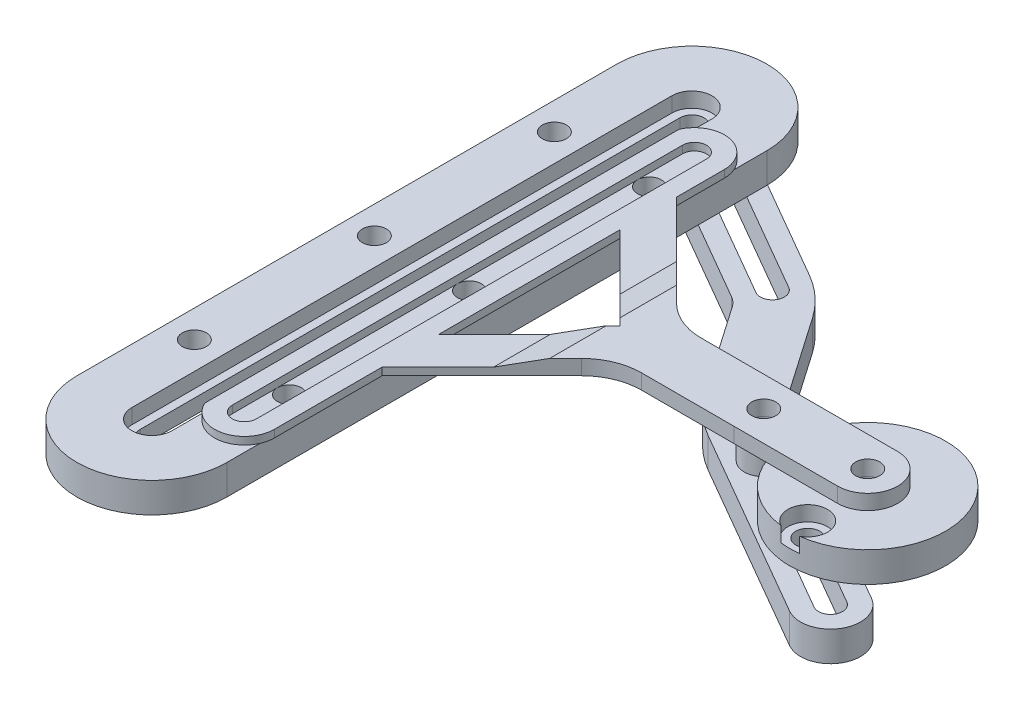
from build123d import *

# Parameters (mm, degrees)
SKETCH8_R                = 16.51
SKETCH8_R_2              = 2.54
BOSS_EXTRUDE1_DEPTH      = 6.35
SKETCH8_3_R              = 2.54
BOSS_EXTRUDE2_DEPTH      = 6.35
BOSS_EXTRUDE3_DEPTH      = 3.175
BOSS_EXTRUDE5_DEPTH      = 6.35
CUT_EXTRUDE1_DEPTH       = 289.337970876
FILLET3_R                = 5.08
FILLET4_R                = 25.4
BOSS_EXTRUDE6_DEPTH      = 3.175
BOSS_EXTRUDE6_DEPTH_BACK = 3.175
BOSS_EXTRUDE7_DEPTH      = 3.175
CUT_EXTRUDE3_DEPTH       = 3.175
SKETCH16_R               = 4.1275
SKETCH16_R_2             = 2.54
BOSS_EXTRUDE8_DEPTH      = 6.35
SKETCH17_R               = 2.54
CUT_EXTRUDE4_DEPTH       = 18.796
SKETCH18_R               = 2.54
CUT_EXTRUDE5_DEPTH       = 18.796
BOSS_EXTRUDE9_OUTLINE_R  = 2.54
BOSS_EXTRUDE9_DEPTH      = 3.175
BOSS_EXTRUDE10_DEPTH     = 1.5875
CHAMFER3_SIZE            = 17.726494926
CHAMFER3_SIZE_2          = 4.7498
SKETCH20_R               = 4.191
CUT_EXTRUDE6_DEPTH       = 3.175


# Read off the part's stored shape, not the designer's step: Boss-Extrude9
with BuildPart() as part:
    # Sketch8 → Boss-Extrude1 (new body)
    with BuildSketch(Plane(origin=(0, 0, 0), x_dir=(1, 0, 0), z_dir=(0, 1, 0))):
        with Locations(Location((201.067045256, -114.3, 0), (0, 0, 270))):
            Circle(SKETCH8_R)
        with Locations(Location((201.067045256, -127, 0), (0, 0, 270))):
            Circle(SKETCH8_R_2, mode=Mode.SUBTRACT)
    extrude(amount=BOSS_EXTRUDE1_DEPTH)

    # Sketch17 → Cut-Extrude4 (cut)
    with BuildSketch(Plane(origin=(0, 6.35, 0), x_dir=(1, 0, 0), z_dir=(0, 1, 0))):
        with Locations(Location((201.067045256, -114.3, 0), (0, 0, 270))):
            Circle(SKETCH17_R)
    extrude(amount=-CUT_EXTRUDE4_DEPTH, mode=Mode.SUBTRACT)

    # Sketch20 → Cut-Extrude6 (cut)
    with BuildSketch(Plane(origin=(0, 6.35, 0), x_dir=(1, 0, 0), z_dir=(0, 1, 0))):
        with Locations((201.067045256, -127)):
            Circle(SKETCH20_R)
    extrude(amount=-CUT_EXTRUDE6_DEPTH, mode=Mode.SUBTRACT)


with BuildPart() as body_2:
    # Sketch8<3> → Boss-Extrude2 (new body)
    with BuildSketch(Plane(origin=(0, 0, 0), x_dir=(1, 0, 0), z_dir=(0, 1, 0))):
        with BuildLine():
            ThreePointArc((209.32976593, -139.102832424), (218.004027244, -136.77857111), (215.67976593, -128.104309796))
            Line((215.67976593, -128.104309796), (110.754602918, -67.525738686))
            ThreePointArc((110.754602918, -67.525738686), (102.080341604, -69.85), (104.404602918, -78.524261314))
            Line((104.404602918, -78.524261314), (209.32976593, -139.102832424))
        make_face()
        with BuildLine():
            ThreePointArc((213.77476593, -131.403866584), (214.704470456, -134.87357111), (211.23476593, -135.803275636))
            Line((211.23476593, -135.803275636), (183.73845936, -119.928275636))
            ThreePointArc((183.73845936, -119.928275636), (182.808754834, -116.45857111), (186.27845936, -115.528866584))
            Line((186.27845936, -115.528866584), (213.77476593, -131.403866584))
        make_face(mode=Mode.SUBTRACT)
        with Locations(Location((179.07, -114.3, 0), (0, 0, 270))):
            Circle(SKETCH8_3_R, mode=Mode.SUBTRACT)
    extrude(amount=-BOSS_EXTRUDE2_DEPTH)

    # Sketch9 → Boss-Extrude5 (add)
    with BuildSketch(Plane.XZ.offset(6.35)):
        with BuildLine():
            Line((158.063383303, 82.98668464), (171.74208472, 102.736877722))
            Line((171.74208472, 102.736877722), (110.754602918, 67.525738686))
            ThreePointArc((110.754602918, 67.525738686), (105.936101981, 66.891371003), (102.080341604, 69.85))
            Line((102.080341604, 69.85), (98.350066501, 67.696324666))
            Line((98.350066501, 67.696324666), (105.335066501, 55.597949775))
            ThreePointArc((105.335066501, 55.597949775), (108.419674804, 53.231046577), (112.274475553, 53.738540724))
            Line((112.274475553, 53.738540724), (149.882418833, 75.4514969))
            ThreePointArc((149.882418833, 75.4514969), (154.390412826, 78.765797637), (158.063383303, 82.98668464))
        make_face()
        with BuildLine():
            Line((108.929327815, 62.072506563), (147.424157014, 84.297506563))
            ThreePointArc((147.424157014, 84.297506563), (150.893861539, 83.367802038), (149.964157014, 79.898097512))
            Line((149.964157014, 79.898097512), (111.469327815, 57.673097512))
            ThreePointArc((111.469327815, 57.673097512), (107.99962329, 58.602802038), (108.929327815, 62.072506563))
        make_face(mode=Mode.SUBTRACT)
    extrude(amount=-BOSS_EXTRUDE5_DEPTH)

    # Sketch10 → Cut-Extrude1 (cut, through all)
    with BuildSketch(Plane.XZ.offset(6.35)):
        with BuildLine():
            Line((163.667728403, 112.739842766), (104.404602918, 78.524261314))
            ThreePointArc((104.404602918, 78.524261314), (101.445973921, 74.668500936), (102.080341604, 69.85))
            Line((102.080341604, 69.85), (98.350066501, 67.696324666))
            Line((98.350066501, 67.696324666), (101.525066501, 62.197063352))
            Line((101.525066501, 62.197063352), (145.519157014, 87.597063352))
            ThreePointArc((145.519157014, 87.597063352), (146.557191217, 88.345236074), (147.424157014, 89.286324666))
            Line((147.424157014, 89.286324666), (163.667728403, 112.739842766))
        make_face()
    extrude(amount=-CUT_EXTRUDE1_DEPTH, mode=Mode.SUBTRACT)

    # Fillet3
    fillet3_edges = [body_2.edges().sort_by_distance(p)[0] for p in [
        (101.525066501, -3.175, 62.197063352),
    ]]
    fillet(fillet3_edges, radius=FILLET3_R)

    # Fillet4
    fillet4_edges = [body_2.edges().sort_by_distance(p)[0] for p in [
        (163.667728403, -3.175, 112.739842766),
        (171.74208472, -3.175, 102.736877722),
    ]]
    fillet(fillet4_edges, radius=FILLET4_R)

    # Sketch16 → Boss-Extrude8 (add)
    with BuildSketch(Plane(origin=(0, 0, 0), x_dir=(1, 0, 0), z_dir=(0, 1, 0))):
        with Locations(Location((179.07, -114.3, 0), (0, 0, 270))):
            Circle(SKETCH16_R)
        with Locations(Location((179.07, -114.3, 0), (0, 0, 270))):
            Circle(SKETCH16_R_2, mode=Mode.SUBTRACT)
    extrude(amount=BOSS_EXTRUDE8_DEPTH)


with BuildPart() as body_3:
    # Sketch8<4> → Boss-Extrude3 (new body)
    with BuildSketch(Plane(origin=(0, 0, 0), x_dir=(1, 0, 0), z_dir=(0, 1, 0))):
        with BuildLine():
            Line((122.555, -63.471788223), (122.555, -177.771788223))
            ThreePointArc((122.555, -177.771788223), (113.03, -187.296788223), (103.505, -177.771788223))
            Line((103.505, -177.771788223), (103.505, -63.471788223))
            ThreePointArc((103.505, -63.471788223), (113.03, -53.946788223), (122.555, -63.471788223))
        make_face()
        with BuildLine():
            Line((115.57, -63.471788223), (115.57, -177.771788223))
            ThreePointArc((115.57, -177.771788223), (113.03, -180.311788223), (110.49, -177.771788223))
            Line((110.49, -177.771788223), (110.49, -63.471788223))
            ThreePointArc((110.49, -63.471788223), (113.03, -60.931788223), (115.57, -63.471788223))
        make_face(mode=Mode.SUBTRACT)
    extrude(amount=BOSS_EXTRUDE3_DEPTH)

    # Sketch12 → Boss-Extrude6 (add, two sides: drawn at the far end of the back side and taken through both)
    with BuildSketch(Plane.XZ.offset(-BOSS_EXTRUDE6_DEPTH_BACK)):
        with BuildLine():
            Line((97.155, 63.471788223), (97.155, 177.771788223))
            ThreePointArc((97.155, 177.771788223), (113.03, 193.646788223), (128.905, 177.771788223))
            Line((128.905, 177.771788223), (128.905, 63.471788223))
            ThreePointArc((128.905, 63.471788223), (113.03, 47.596788223), (97.155, 63.471788223))
        make_face()
        with BuildLine():
            Line((122.555, 63.471788223), (122.555, 177.771788223))
            ThreePointArc((122.555, 177.771788223), (113.03, 187.296788223), (103.505, 177.771788223))
            Line((103.505, 177.771788223), (103.505, 63.471788223))
            ThreePointArc((103.505, 63.471788223), (113.03, 53.946788223), (122.555, 63.471788223))
        make_face(mode=Mode.SUBTRACT)
    extrude(amount=BOSS_EXTRUDE6_DEPTH + BOSS_EXTRUDE6_DEPTH_BACK)

    # Sketch13 → Boss-Extrude7 (add)
    with BuildSketch(Plane(origin=(0, 3.175, 0), x_dir=(1, 0, 0), z_dir=(0, 1, 0))):
        with BuildLine():
            Line((128.905, -177.771788223), (128.905, -63.471788223))
            ThreePointArc((128.905, -63.471788223), (113.03, -47.596788223), (97.155, -63.471788223))
            Line((97.155, -63.471788223), (97.155, -177.771788223))
            ThreePointArc((97.155, -177.771788223), (113.03, -193.646788223), (128.905, -177.771788223))
        make_face()
        with BuildLine():
            ThreePointArc((117.28, -63.471788223), (113.03, -59.221788223), (108.78, -63.471788223))
            Line((108.78, -63.471788223), (108.78, -177.771788223))
            ThreePointArc((108.78, -177.771788223), (113.03, -182.021788223), (117.28, -177.771788223))
            Line((117.28, -177.771788223), (117.28, -63.471788223))
        make_face(mode=Mode.SUBTRACT)
    extrude(amount=BOSS_EXTRUDE7_DEPTH)

    # Sketch15 → Cut-Extrude3 (cut)
    with BuildSketch(Plane.XZ.offset(3.175)):
        with BuildLine():
            Line((128.905, 63.471788223), (128.905, 177.771788223))
            ThreePointArc((128.905, 177.771788223), (113.03, 193.646788223), (97.155, 177.771788223))
            Line((97.155, 177.771788223), (97.155, 63.471788223))
            ThreePointArc((97.155, 63.471788223), (113.03, 47.596788223), (128.905, 63.471788223))
        make_face()
    extrude(amount=-CUT_EXTRUDE3_DEPTH, mode=Mode.SUBTRACT)

    # Sketch18 → Cut-Extrude5 (cut)
    with BuildSketch(Plane(origin=(0, 6.35, 0), x_dir=(1, 0, 0), z_dir=(0, 1, 0))):
        with Locations(Location((123.0925, -158.721788223, 0), (0, 0, 270))):
            Circle(SKETCH18_R)
        with Locations(Location((123.0925, -82.521788223, 0), (0, 0, 270))):
            Circle(SKETCH18_R)
        with Locations(Location((123.0925, -120.621788223, 0), (0, 0, 270))):
            Circle(SKETCH18_R)
        with Locations(Location((102.9675, -82.521788223, 0), (0, 0, 270))):
            Circle(SKETCH18_R)
        with Locations(Location((102.9675, -120.621788223, 0), (0, 0, 270))):
            Circle(SKETCH18_R)
        with Locations(Location((102.9675, -158.721788223, 0), (0, 0, 270))):
            Circle(SKETCH18_R)
    extrude(amount=-CUT_EXTRUDE5_DEPTH, mode=Mode.SUBTRACT)


with BuildPart() as body_4:
    # Boss-Extrude9 outline → Boss-Extrude9 (new body)
    with BuildSketch(Plane(origin=(0, 6.35, 0), x_dir=(1, 0, 0), z_dir=(0, 1, 0))):
        with BuildLine():
            Line((201.067045256, -107.95), (159.516762242, -107.95))
            ThreePointArc((159.516762242, -107.95), (154.656682651, -106.983270063), (150.536506121, -104.230256121))
            Line((150.536506121, -104.230256121), (129.4425, -83.13625))
            Line((129.4425, -83.13625), (129.4425, -95.124030717))
            Line((129.4425, -95.124030717), (148.618469283, -114.3))
            Line((148.618469283, -114.3), (129.4425, -133.475969283))
            Line((129.4425, -133.475969283), (129.4425, -145.449644111))
            Line((129.4425, -145.449644111), (150.533515322, -124.358628789))
            ThreePointArc((150.533515322, -124.358628789), (154.657027058, -121.604233915), (159.52099102, -120.638886962))
            Line((159.52099102, -120.638886962), (179.07, -120.65))
            Line((179.07, -120.65), (201.067045256, -120.65))
            ThreePointArc((201.067045256, -120.65), (207.417045256, -114.3), (201.067045256, -107.95))
        make_face()
        with Locations((179.07, -114.3)):
            Circle(BOSS_EXTRUDE9_OUTLINE_R, mode=Mode.SUBTRACT)
        with Locations((201.067045256, -114.3)):
            Circle(BOSS_EXTRUDE9_OUTLINE_R, mode=Mode.SUBTRACT)
    extrude(amount=BOSS_EXTRUDE9_DEPTH)

    # Sketch19<3> → Boss-Extrude10 (add)
    # profile 1 of 2: a face of its own
    with BuildSketch(Plane(origin=(0, 6.35, 0), x_dir=(1, 0, 0), z_dir=(0, 1, 0))):
        with BuildLine():
            Line((117.28, -70.439965243), (117.28, -170.803611203))
            ThreePointArc((117.28, -170.803611203), (123.0925, -174.596788223), (128.905, -170.803611203))
            Line((128.905, -170.803611203), (128.905, -70.439965243))
            ThreePointArc((128.905, -70.439965243), (123.0925, -66.646788223), (117.28, -70.439965243))
        make_face()
        with BuildLine():
            ThreePointArc((125.6325, -168.246788223), (123.0925, -170.786788223), (120.5525, -168.246788223))
            Line((120.5525, -168.246788223), (120.5525, -158.721788223))
            Line((120.5525, -158.721788223), (120.5525, -120.621788223))
            Line((120.5525, -120.621788223), (120.5525, -82.521788223))
            Line((120.5525, -82.521788223), (120.5525, -72.996788223))
            ThreePointArc((120.5525, -72.996788223), (123.0925, -70.456788223), (125.6325, -72.996788223))
            Line((125.6325, -72.996788223), (125.6325, -82.521788223))
            Line((125.6325, -82.521788223), (125.6325, -120.621788223))
            Line((125.6325, -120.621788223), (125.6325, -158.721788223))
            Line((125.6325, -158.721788223), (125.6325, -168.246788223))
        make_face(mode=Mode.SUBTRACT)
    # profile 2 of 2: a face of its own
    with BuildSketch(Plane(origin=(0, 6.35, 0), x_dir=(1, 0, 0), z_dir=(0, 1, 0))):
        with BuildLine():
            Line((128.905, -70.439965243), (128.905, -170.803611203))
            ThreePointArc((128.905, -170.803611203), (129.30667231, -169.553142884), (129.4425, -168.246788223))
            Line((129.4425, -168.246788223), (129.4425, -145.449644111))
            Line((129.4425, -145.449644111), (129.4425, -133.475969283))
            Line((129.4425, -133.475969283), (129.4425, -95.124030717))
            Line((129.4425, -95.124030717), (129.4425, -83.13625))
            Line((129.4425, -83.13625), (129.4425, -72.996788223))
            ThreePointArc((129.4425, -72.996788223), (129.30667231, -71.690433562), (128.905, -70.439965243))
        make_face()
    extrude(amount=BOSS_EXTRUDE10_DEPTH)

    # Chamfer3
    # the kernel refuses this chamfer: 17.726494926, 4.7498 mm, written as the material it adds along each edge
    # the kernel refuses this chamfer: 17.726494926, 4.7498 mm, written as the material it takes off along each edge
    with BuildSketch(Plane(origin=(129.4425, 9.525, 37.105478262), x_dir=(0.9999503267608394, 0.009967146577156326, 0), z_dir=(0, 0, 1))) as chamfer3_2_piece_1_section:
        Polygon((CHAMFER3_SIZE * 0.999950326749, -CHAMFER3_SIZE * 0.00996714657704), (-CHAMFER3_SIZE_2 * 0.00996714657716, -CHAMFER3_SIZE_2 * 0.999950326761), (0, 0), align=None)
    chamfer3_2_piece_1 = extrude(amount=104.049324193, mode=Mode.PRIVATE)
    chamfer3_2_piece_1 = split(chamfer3_2_piece_1, bisect_by=Plane(origin=(136.923650638, 7.9375, 96.611290996), z_dir=(0, 1, 0)), keep=Keep.TOP, mode=Mode.PRIVATE)
    add(chamfer3_2_piece_1, mode=Mode.SUBTRACT)
    with BuildSketch(Plane(origin=(129.4425, 9.525, 87.445197545), x_dir=(0.9999503267608394, 0.009967146577156326, 0), z_dir=(0, 0, 1))) as chamfer3_2_piece_2_section:
        Polygon((CHAMFER3_SIZE * 0.999950326749, -CHAMFER3_SIZE * 0.00996714657704), (-CHAMFER3_SIZE_2 * 0.00996714657716, -CHAMFER3_SIZE_2 * 0.999950326761), (0, 0), align=None)
    chamfer3_2_piece_2 = extrude(amount=104.035218304, mode=Mode.PRIVATE)
    chamfer3_2_piece_2 = split(chamfer3_2_piece_2, bisect_by=Plane(origin=(137.258267367, 7.9375, 97.198195957), z_dir=(0, 1, 0)), keep=Keep.TOP, mode=Mode.PRIVATE)
    add(chamfer3_2_piece_2, mode=Mode.SUBTRACT)


solid = Compound([part.part, body_2.part, body_3.part, body_4.part])
